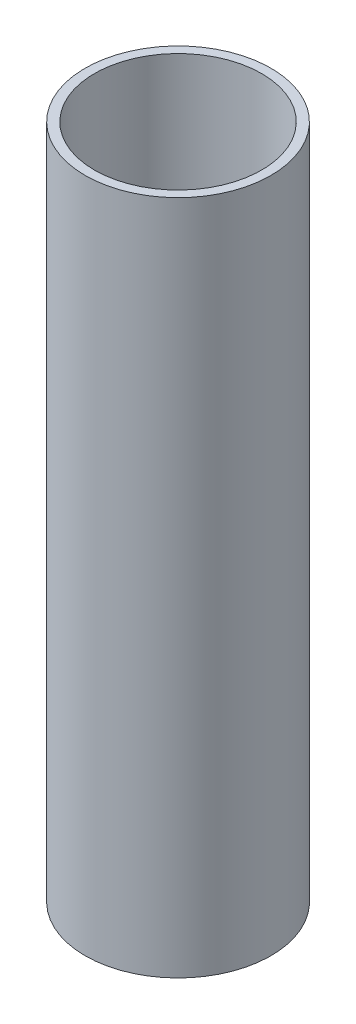
from build123d import *

# Parameters (mm, degrees)
SKETCH1_R           = 16.5
SKETCH1_R_2         = 14.85
BOSS_EXTRUDE1_DEPTH = 60


with BuildPart() as part:
    # Sketch1 → Boss-Extrude1 (new, symmetric)
    with BuildSketch(Plane(origin=(0, 0, 0), x_dir=(1, 0, 0), z_dir=(0, 1, 0))):
        Circle(SKETCH1_R)
        Circle(SKETCH1_R_2, mode=Mode.SUBTRACT)
    extrude(amount=BOSS_EXTRUDE1_DEPTH, both=True)


solid = part.part
